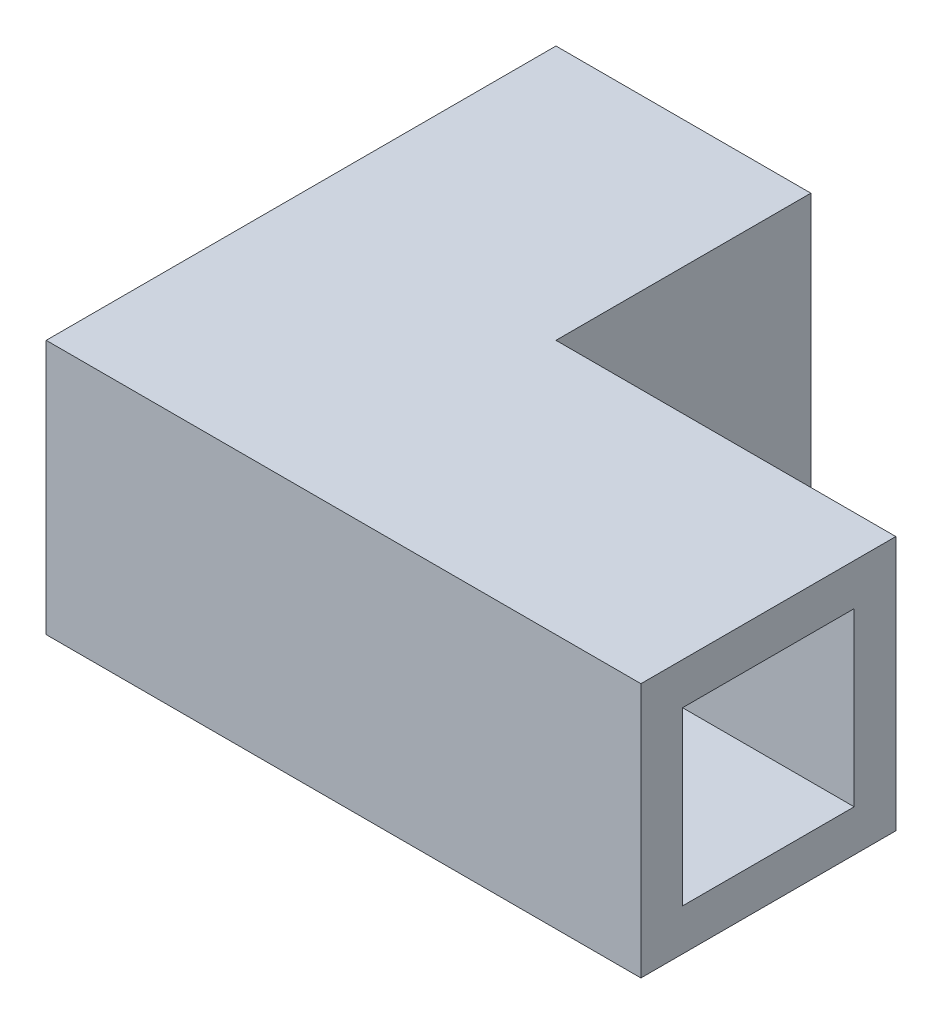
from build123d import *

# Parameters (mm, degrees)
BOSS_EXTRUDE1_DEPTH = 15
SKETCH2_W           = 10.1
SKETCH2_H           = 10.1
CUT_EXTRUDE1_DEPTH  = 20
SKETCH3_W           = 10.1
SKETCH3_H           = 10.1
CUT_EXTRUDE2_DEPTH  = 17
SKETCH4_W           = 8
SKETCH4_H           = 8
CUT_EXTRUDE3_DEPTH  = 4
CUT_EXTRUDE4_REACH  = 41.051
SKETCH5_W           = 8
SKETCH5_H           = 8
FILLET1_R           = 5


with BuildPart() as part:
    # Sketch1 → Boss-Extrude1 (new body)
    with BuildSketch(Plane(origin=(0, 0, 0), x_dir=(1, 0, 0), z_dir=(0, 1, 0))):
        Polygon((0, 0), (20, 0), (20, 15), (0, 15), (0, 30), (-15, 30), (-15, 0), align=None)
    extrude(amount=BOSS_EXTRUDE1_DEPTH)

    # Sketch2 → Cut-Extrude1 (cut)
    with BuildSketch(Plane(origin=(20, 0, 0), x_dir=(0, 0, -1), z_dir=(1, 0, 0))):
        with Locations((7.5, 7.5)):
            Rectangle(SKETCH2_W, SKETCH2_H)
    extrude(amount=-CUT_EXTRUDE1_DEPTH, mode=Mode.SUBTRACT)

    # Sketch3 → Cut-Extrude2 (cut)
    with BuildSketch(Plane(origin=(0, 0, -30), x_dir=(-1, 0, 0), z_dir=(0, 0, -1))):
        with Locations((7.5, 7.5)):
            Rectangle(SKETCH3_W, SKETCH3_H)
    extrude(amount=-CUT_EXTRUDE2_DEPTH, mode=Mode.SUBTRACT)

    # Sketch4 → Cut-Extrude3 (cut)
    with BuildSketch(Plane(origin=(0, 0, -13), x_dir=(-1, 0, 0), z_dir=(0, 0, -1))):
        with Locations((7.5, 7.5)):
            Rectangle(SKETCH4_W, SKETCH4_H)
    extrude(amount=-CUT_EXTRUDE3_DEPTH, mode=Mode.SUBTRACT)

    # Cut-Extrude4: up to this face of the body (flat: up to its plane)
    cut_extrude4_end = Plane(part.part.faces().sort_by_distance((-11.5, 7.5, -11))[0])
    # Sketch5 → Cut-Extrude4 (cut, up to the picked face)
    with BuildSketch(Plane(origin=(0, 0, 0), x_dir=(0, 0, -1), z_dir=(1, 0, 0)), mode=Mode.PRIVATE) as cut_extrude4_sk1:
        with Locations((7.5, 7.5)):
            Rectangle(SKETCH5_W, SKETCH5_H)
    cut_extrude4_tool1 = split(extrude(cut_extrude4_sk1.sketch, amount=-CUT_EXTRUDE4_REACH, mode=Mode.PRIVATE), bisect_by=cut_extrude4_end, keep=Keep.BOTH, mode=Mode.PRIVATE)
    add(cut_extrude4_tool1.solids().sort_by(Axis((0, 7.5, -7.5), (-1, 0, 0)))[0], mode=Mode.SUBTRACT)

    # Fillet1
    # the kernel refuses this fillet: 5 mm, written as the material it adds along each edge
    with BuildSketch(Plane(origin=(-11.5, -9, -3.5), x_dir=(1, 0, 0), z_dir=(0, 1, 0))) as fillet1_piece_1_section:
        with BuildLine():
            CenterArc((FILLET1_R, FILLET1_R), FILLET1_R, 180, 90)
            Line((0, FILLET1_R), (0, 0))
            Line((0, 0), (FILLET1_R, 0))
        make_face()
    fillet1_piece_1 = extrude(amount=20.5, mode=Mode.PRIVATE)
    fillet1_piece_1 = split(fillet1_piece_1, bisect_by=Plane(origin=(-11.5, 0, -3.5), z_dir=(0, 1, 0)), keep=Keep.TOP, mode=Mode.PRIVATE)
    add(fillet1_piece_1)
    # the kernel refuses this fillet: 5 mm, written as the material it takes off along each edge
    with BuildSketch(Plane(origin=(-3.5, 3.5, -11.5), x_dir=(1, 0, 0), z_dir=(0, 1, 0))) as fillet1_2_piece_1:
        with BuildLine():
            CenterArc((3.570714214, 5), FILLET1_R, 224.427004001, 45.572995999)
            Line((0, 1.5), (0, 0))
            Line((0, 0), (3.570714214, 0))
        make_face()
    extrude(amount=8, mode=Mode.SUBTRACT)


solid = part.part
